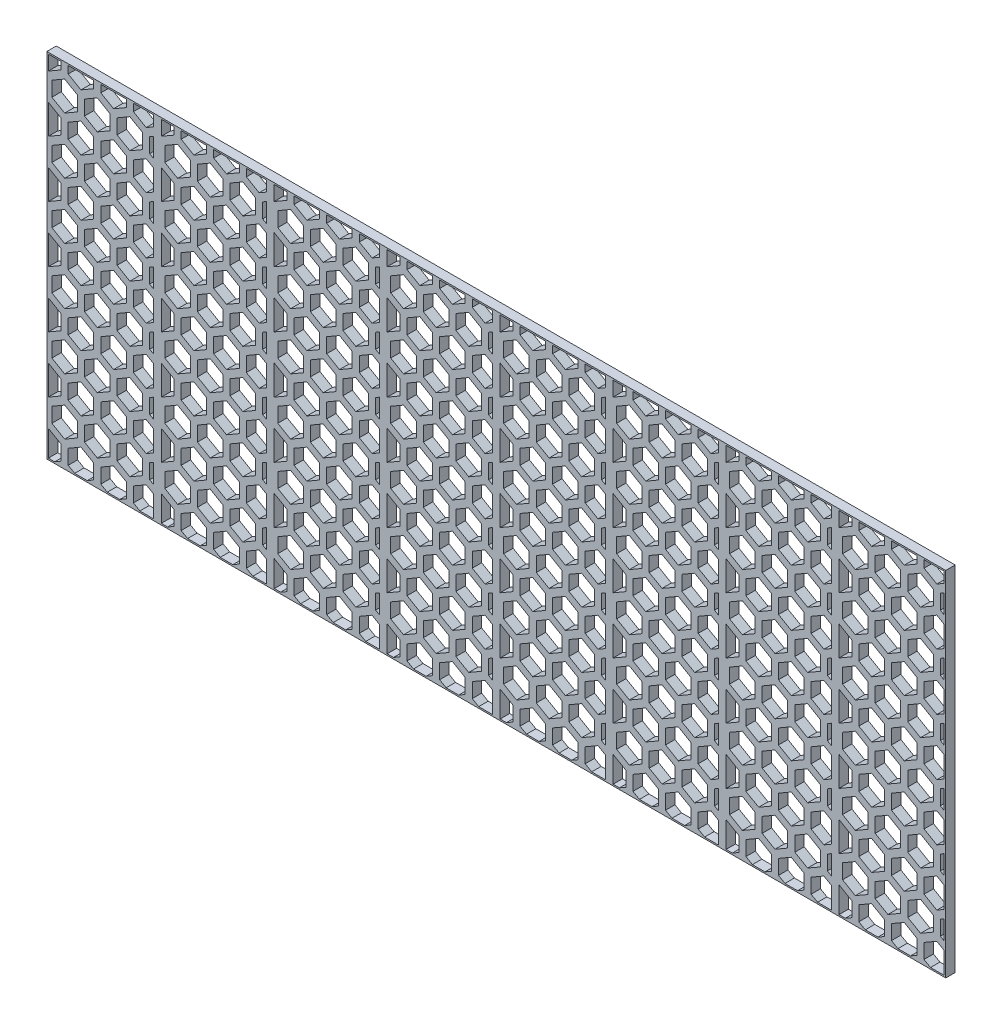
from build123d import *

# Parameters (mm, degrees)
BOSS_EXTRUDE1_DEPTH = 6.35
SKETCH2_W           = 76.2
SKETCH2_H           = 238.125
SKETCH2_W_2         = 70.993
SKETCH2_H_2         = 236.093
BOSS_EXTRUDE3_DEPTH = 6.35
LPATTERN1_COUNT     = 8
LPATTERN1_PITCH     = 76.2
SKETCH5_W           = 6.35
SKETCH5_H           = 238.125
CUT_EXTRUDE1_DEPTH  = 1.5875
SKETCH6_W           = 6.35
SKETCH6_H           = 238.125
CUT_EXTRUDE2_DEPTH  = 1.5875


with BuildPart() as part:
    # Boss-Extrude1: read off the stored shape, not the designer's step
    # Boss-Extrude1 outline → Boss-Extrude1 (new body)
    with BuildSketch(Plane.XY):
        Polygon((68.376365969, 222.015886702), (70.993, 223.526601064), (70.993, 229.035054257), (65.991135768, 226.147226596), (57.377843341, 231.120113298), (57.377843341, 236.093), (52.60738294, 236.093), (52.60738294, 231.120113298), (43.994090512, 226.147226596), (35.380798084, 231.120113298), (35.380798084, 236.093), (30.610337684, 236.093), (30.610337684, 231.120113298), (21.997045256, 226.147226596), (13.383752828, 231.120113298), (13.383752828, 236.093), (8.613292428, 236.093), (8.613292428, 231.120113298), (0, 226.147226596), (0, 207.938773404), (8.613292428, 202.965886702), (8.613292428, 193.020113298), (0, 188.047226596), (0, 169.838773404), (8.613292428, 164.865886702), (8.613292428, 154.920113298), (0, 149.947226596), (0, 131.738773404), (8.613292428, 126.765886702), (8.613292428, 116.820113298), (0, 111.847226596), (0, 93.638773404), (8.613292428, 88.665886702), (8.613292428, 78.720113298), (0, 73.747226596), (0, 55.538773404), (8.613292428, 50.565886702), (8.613292428, 40.620113298), (0, 35.647226596), (0, 17.438773404), (8.613292428, 12.465886702), (8.613292428, 2.520113298), (4.248328154, 0), (17.748717102, 0), (13.383752828, 2.520113298), (13.383752828, 12.465886702), (21.997045256, 17.438773404), (30.610337684, 12.465886702), (30.610337684, 2.520113298), (26.245373411, 0), (39.745762358, 0), (35.380798084, 2.520113298), (35.380798084, 12.465886702), (43.994090512, 17.438773404), (52.60738294, 12.465886702), (52.60738294, 2.520113298), (48.242418667, 0), (61.742807614, 0), (57.377843341, 2.520113298), (57.377843341, 12.465886702), (65.991135768, 17.438773404), (70.993, 14.550945743), (70.993, 20.059398936), (68.376365969, 21.570113298), (68.376365969, 31.515886702), (70.993, 33.026601064), (70.993, 38.535054257), (65.991135768, 35.647226596), (57.377843341, 40.620113298), (57.377843341, 50.565886702), (65.991135768, 55.538773404), (70.993, 52.650945743), (70.993, 58.159398936), (68.376365969, 59.670113298), (68.376365969, 69.615886702), (70.993, 71.126601064), (70.993, 76.635054257), (65.991135768, 73.747226596), (57.377843341, 78.720113298), (57.377843341, 88.665886702), (65.991135768, 93.638773404), (70.993, 90.750945743), (70.993, 96.259398936), (68.376365969, 97.770113298), (68.376365969, 107.715886702), (70.993, 109.226601064), (70.993, 114.735054257), (65.991135768, 111.847226596), (57.377843341, 116.820113298), (57.377843341, 126.765886702), (65.991135768, 131.738773404), (70.993, 128.850945743), (70.993, 134.359398936), (68.376365969, 135.870113298), (68.376365969, 145.815886702), (70.993, 147.326601064), (70.993, 152.835054257), (65.991135768, 149.947226596), (57.377843341, 154.920113298), (57.377843341, 164.865886702), (65.991135768, 169.838773404), (70.993, 166.950945743), (70.993, 172.459398936), (68.376365969, 173.970113298), (68.376365969, 183.915886702), (70.993, 185.426601064), (70.993, 190.935054257), (65.991135768, 188.047226596), (57.377843341, 193.020113298), (57.377843341, 202.965886702), (65.991135768, 207.938773404), (70.993, 205.050945743), (70.993, 210.559398936), (68.376365969, 212.070113298), align=None)
        Polygon((10.998522628, 36.488773404), (19.611815056, 31.515886702), (19.611815056, 21.570113298), (10.998522628, 16.597226596), (2.3852302, 21.570113298), (2.3852302, 31.515886702), align=None, mode=Mode.SUBTRACT)
        Polygon((32.995567884, 36.488773404), (41.608860312, 31.515886702), (41.608860312, 21.570113298), (32.995567884, 16.597226596), (24.382275456, 21.570113298), (24.382275456, 31.515886702), align=None, mode=Mode.SUBTRACT)
        Polygon((21.997045256, 55.538773404), (30.610337684, 50.565886702), (30.610337684, 40.620113298), (21.997045256, 35.647226596), (13.383752828, 40.620113298), (13.383752828, 50.565886702), align=None, mode=Mode.SUBTRACT)
        Polygon((10.998522628, 74.588773404), (19.611815056, 69.615886702), (19.611815056, 59.670113298), (10.998522628, 54.697226596), (2.3852302, 59.670113298), (2.3852302, 69.615886702), align=None, mode=Mode.SUBTRACT)
        Polygon((10.998522628, 112.688773404), (19.611815056, 107.715886702), (19.611815056, 97.770113298), (10.998522628, 92.797226596), (2.3852302, 97.770113298), (2.3852302, 107.715886702), align=None, mode=Mode.SUBTRACT)
        Polygon((21.997045256, 93.638773404), (30.610337684, 88.665886702), (30.610337684, 78.720113298), (21.997045256, 73.747226596), (13.383752828, 78.720113298), (13.383752828, 88.665886702), align=None, mode=Mode.SUBTRACT)
        Polygon((32.995567884, 74.588773404), (41.608860312, 69.615886702), (41.608860312, 59.670113298), (32.995567884, 54.697226596), (24.382275456, 59.670113298), (24.382275456, 69.615886702), align=None, mode=Mode.SUBTRACT)
        Polygon((32.995567884, 112.688773404), (41.608860312, 107.715886702), (41.608860312, 97.770113298), (32.995567884, 92.797226596), (24.382275456, 97.770113298), (24.382275456, 107.715886702), align=None, mode=Mode.SUBTRACT)
        Polygon((43.994090512, 55.538773404), (52.60738294, 50.565886702), (52.60738294, 40.620113298), (43.994090512, 35.647226596), (35.380798084, 40.620113298), (35.380798084, 50.565886702), align=None, mode=Mode.SUBTRACT)
        Polygon((54.99261314, 36.488773404), (63.605905568, 31.515886702), (63.605905568, 21.570113298), (54.99261314, 16.597226596), (46.379320713, 21.570113298), (46.379320713, 31.515886702), align=None, mode=Mode.SUBTRACT)
        Polygon((43.994090512, 93.638773404), (52.60738294, 88.665886702), (52.60738294, 78.720113298), (43.994090512, 73.747226596), (35.380798084, 78.720113298), (35.380798084, 88.665886702), align=None, mode=Mode.SUBTRACT)
        Polygon((54.99261314, 74.588773404), (63.605905568, 69.615886702), (63.605905568, 59.670113298), (54.99261314, 54.697226596), (46.379320713, 59.670113298), (46.379320713, 69.615886702), align=None, mode=Mode.SUBTRACT)
        Polygon((54.99261314, 112.688773404), (63.605905568, 107.715886702), (63.605905568, 97.770113298), (54.99261314, 92.797226596), (46.379320713, 97.770113298), (46.379320713, 107.715886702), align=None, mode=Mode.SUBTRACT)
        Polygon((10.998522628, 150.788773404), (19.611815056, 145.815886702), (19.611815056, 135.870113298), (10.998522628, 130.897226596), (2.3852302, 135.870113298), (2.3852302, 145.815886702), align=None, mode=Mode.SUBTRACT)
        Polygon((21.997045256, 131.738773404), (30.610337684, 126.765886702), (30.610337684, 116.820113298), (21.997045256, 111.847226596), (13.383752828, 116.820113298), (13.383752828, 126.765886702), align=None, mode=Mode.SUBTRACT)
        Polygon((32.995567884, 150.788773404), (41.608860312, 145.815886702), (41.608860312, 135.870113298), (32.995567884, 130.897226596), (24.382275456, 135.870113298), (24.382275456, 145.815886702), align=None, mode=Mode.SUBTRACT)
        Polygon((21.997045256, 169.838773404), (30.610337684, 164.865886702), (30.610337684, 154.920113298), (21.997045256, 149.947226596), (13.383752828, 154.920113298), (13.383752828, 164.865886702), align=None, mode=Mode.SUBTRACT)
        Polygon((10.998522628, 188.888773404), (19.611815056, 183.915886702), (19.611815056, 173.970113298), (10.998522628, 168.997226596), (2.3852302, 173.970113298), (2.3852302, 183.915886702), align=None, mode=Mode.SUBTRACT)
        Polygon((10.998522628, 226.988773404), (19.611815056, 222.015886702), (19.611815056, 212.070113298), (10.998522628, 207.097226596), (2.3852302, 212.070113298), (2.3852302, 222.015886702), align=None, mode=Mode.SUBTRACT)
        Polygon((21.997045256, 207.938773404), (30.610337684, 202.965886702), (30.610337684, 193.020113298), (21.997045256, 188.047226596), (13.383752828, 193.020113298), (13.383752828, 202.965886702), align=None, mode=Mode.SUBTRACT)
        Polygon((32.995567884, 188.888773404), (41.608860312, 183.915886702), (41.608860312, 173.970113298), (32.995567884, 168.997226596), (24.382275456, 173.970113298), (24.382275456, 183.915886702), align=None, mode=Mode.SUBTRACT)
        Polygon((32.995567884, 226.988773404), (41.608860312, 222.015886702), (41.608860312, 212.070113298), (32.995567884, 207.097226596), (24.382275456, 212.070113298), (24.382275456, 222.015886702), align=None, mode=Mode.SUBTRACT)
        Polygon((43.994090512, 131.738773404), (52.60738294, 126.765886702), (52.60738294, 116.820113298), (43.994090512, 111.847226596), (35.380798084, 116.820113298), (35.380798084, 126.765886702), align=None, mode=Mode.SUBTRACT)
        Polygon((43.994090512, 169.838773404), (52.60738294, 164.865886702), (52.60738294, 154.920113298), (43.994090512, 149.947226596), (35.380798084, 154.920113298), (35.380798084, 164.865886702), align=None, mode=Mode.SUBTRACT)
        Polygon((54.99261314, 150.788773404), (63.605905568, 145.815886702), (63.605905568, 135.870113298), (54.99261314, 130.897226596), (46.379320713, 135.870113298), (46.379320713, 145.815886702), align=None, mode=Mode.SUBTRACT)
        Polygon((43.994090512, 207.938773404), (52.60738294, 202.965886702), (52.60738294, 193.020113298), (43.994090512, 188.047226596), (35.380798084, 193.020113298), (35.380798084, 202.965886702), align=None, mode=Mode.SUBTRACT)
        Polygon((54.99261314, 188.888773404), (63.605905568, 183.915886702), (63.605905568, 173.970113298), (54.99261314, 168.997226596), (46.379320713, 173.970113298), (46.379320713, 183.915886702), align=None, mode=Mode.SUBTRACT)
        Polygon((54.99261314, 226.988773404), (63.605905568, 222.015886702), (63.605905568, 212.070113298), (54.99261314, 207.097226596), (46.379320713, 212.070113298), (46.379320713, 222.015886702), align=None, mode=Mode.SUBTRACT)
    extrude(amount=BOSS_EXTRUDE1_DEPTH)

    # Sketch2 → Boss-Extrude3 (add)
    with BuildSketch(Plane.XY):
        with Locations((35.4965, 118.0465)):
            Rectangle(SKETCH2_W, SKETCH2_H)
        with Locations((35.4965, 118.0465)):
            Rectangle(SKETCH2_W_2, SKETCH2_H_2, mode=Mode.SUBTRACT)
    extrude(amount=BOSS_EXTRUDE3_DEPTH)


with BuildPart() as lpattern1_1:
    # LPattern1: pattern copy
    add(part.part.moved(Location(Vector(1, 0, 0) * (1 * LPATTERN1_PITCH))))


with BuildPart() as lpattern1_2:
    # LPattern1: pattern copy
    add(part.part.moved(Location(Vector(1, 0, 0) * (2 * LPATTERN1_PITCH))))


with BuildPart() as lpattern1_3:
    # LPattern1: pattern copy
    add(part.part.moved(Location(Vector(1, 0, 0) * (3 * LPATTERN1_PITCH))))


with BuildPart() as lpattern1_4:
    # LPattern1: pattern copy
    add(part.part.moved(Location(Vector(1, 0, 0) * (4 * LPATTERN1_PITCH))))


with BuildPart() as lpattern1_5:
    # LPattern1: pattern copy
    add(part.part.moved(Location(Vector(1, 0, 0) * (5 * LPATTERN1_PITCH))))


with BuildPart() as lpattern1_6:
    # LPattern1: pattern copy
    add(part.part.moved(Location(Vector(1, 0, 0) * (6 * LPATTERN1_PITCH))))


with BuildPart() as lpattern1_7:
    # LPattern1: pattern copy
    add(part.part.moved(Location(Vector(1, 0, 0) * (7 * LPATTERN1_PITCH))))

    # Sketch6 → Cut-Extrude2 (cut)
    with BuildSketch(Plane(origin=(606.9965, 0, 0), x_dir=(0, 0, -1), z_dir=(1, 0, 0))):
        with Locations((-3.175, 118.0465)):
            Rectangle(SKETCH6_W, SKETCH6_H)
    extrude(amount=-CUT_EXTRUDE2_DEPTH, mode=Mode.SUBTRACT)


with BuildPart() as part_1:
    add(part.part)

    # Sketch5 → Cut-Extrude1 (cut)
    with BuildSketch(Plane.ZY.offset(2.6035)):
        with Locations((3.175, 118.0465)):
            Rectangle(SKETCH5_W, SKETCH5_H)
    extrude(amount=-CUT_EXTRUDE1_DEPTH, mode=Mode.SUBTRACT)


with BuildPart() as lpattern1_5_1:
    add(lpattern1_5.part)

    # Combine1: union LPattern1_7, LPattern1_2, LPattern1_4, LPattern1_6, LPattern1_1, part, LPattern1_3
    add(lpattern1_7.part)
    add(lpattern1_2.part)
    add(lpattern1_4.part)
    add(lpattern1_6.part)
    add(lpattern1_1.part)
    add(part_1.part)
    add(lpattern1_3.part)


solid = lpattern1_5_1.part
